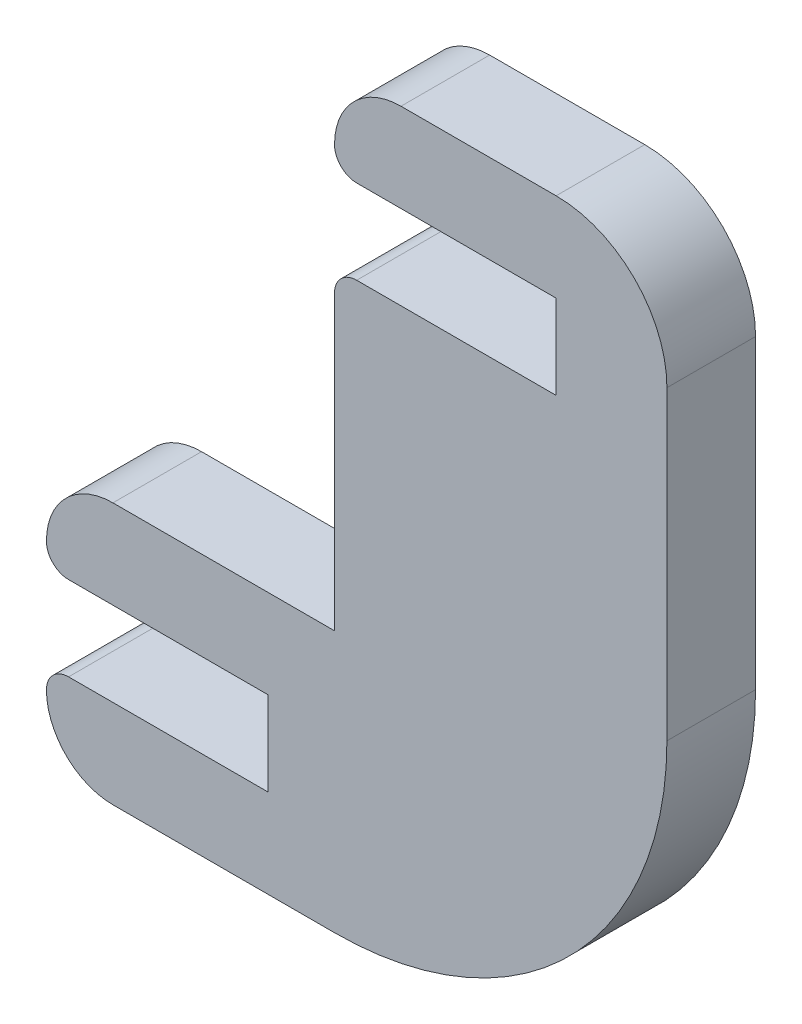
from build123d import *

# Parameters (mm, degrees)
ESTRUSIONE_ESTRUSIONE1_DEPTH = 4
RACCORDO1_R                  = 1
RACCORDO2_R                  = 3
RACCORDO3_R                  = 5
RACCORDO4_R                  = 15


with BuildPart() as part:
    # Schizzo1 → Estrusione-Estrusione1 (new body)
    with BuildSketch(Plane.XY):
        Polygon((-15, 33.8), (0, 33.8), (0, 0), (-28, 0), (-28, 4), (-18, 4), (-18, 7.8), (-28, 7.8), (-28, 11.8), (-15, 11.8), (-15, 26), (-5, 26), (-5, 29.8), (-15, 29.8), align=None)
    extrude(amount=ESTRUSIONE_ESTRUSIONE1_DEPTH)

    # Raccordo1
    raccordo1_edges = [part.edges().sort_by_distance(p)[0] for p in [
        (-28, 4, 2),
        (-28, 7.8, 2),
        (-15, 26, 2),
        (-15, 29.8, 2),
    ]]
    fillet(raccordo1_edges, radius=RACCORDO1_R)

    # Raccordo2
    raccordo2_edges = [part.edges().sort_by_distance(p)[0] for p in [
        (-28, 0, 2),
        (-28, 11.8, 2),
        (-15, 33.8, 2),
    ]]
    fillet(raccordo2_edges, radius=RACCORDO2_R - 0.0001)  # a hair under: the kernel refuses the full size

    # Raccordo3
    raccordo3_edges = [part.edges().sort_by_distance(p)[0] for p in [
        (0, 33.8, 2),
    ]]
    fillet(raccordo3_edges, radius=RACCORDO3_R)

    # Raccordo4
    raccordo4_edges = [part.edges().sort_by_distance(p)[0] for p in [
        (0, 0, 2),
    ]]
    fillet(raccordo4_edges, radius=RACCORDO4_R)


solid = part.part
